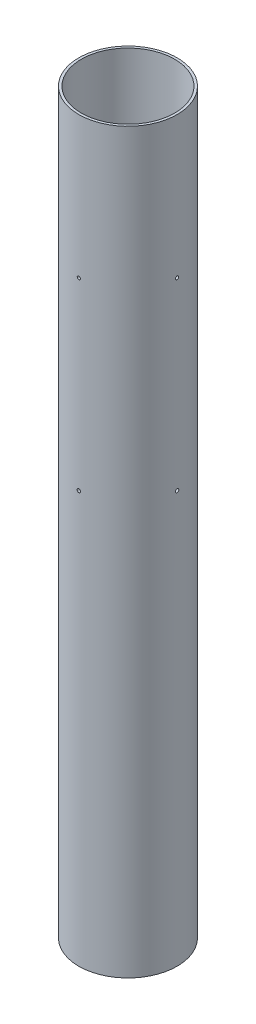
from build123d import *

# Parameters (mm, degrees)
SKETCH1_R                 = 50.8
SKETCH1_R_2               = 48.26
COUPLER_EXTRUSION_DEPTH   = 762
BULKHEAD_HOLE_REACH       = 772.42
SKETCH2_R                 = 1.6383
CIRPATTERN1_COUNT         = 4
LOWER_BULKHEAD_HOLE_REACH = 772.42
SKETCH3_R                 = 1.7526
CIRPATTERN2_COUNT         = 4


with BuildPart() as part:
    # Sketch1 → Coupler Extrusion (new body)
    with BuildSketch(Plane(origin=(0, 0, 0), x_dir=(1, 0, 0), z_dir=(0, 1, 0))):
        Circle(SKETCH1_R)
        Circle(SKETCH1_R_2, mode=Mode.SUBTRACT)
    extrude(amount=COUPLER_EXTRUSION_DEPTH)

    # Sketch2 → Bulkhead Hole (cut, up to next)
    with BuildSketch(Plane.XY.offset(50.8), mode=Mode.PRIVATE) as bulkhead_hole_sk1:
        with Locations((0, 615.95)):
            Circle(SKETCH2_R)
    bulkhead_hole_tool1 = extrude(bulkhead_hole_sk1.sketch, amount=-BULKHEAD_HOLE_REACH, mode=Mode.PRIVATE) & part.part
    bulkhead_hole = bulkhead_hole_tool1.solids().sort_by_distance((0, 615.95, 50.8))[0]
    add(bulkhead_hole, mode=Mode.SUBTRACT)

    # CirPattern1: Bulkhead Hole ×4 about axis
    cirpattern1_axis = Axis((0, 762, 0), (0, -1, 0))
    for i in range(1, CIRPATTERN1_COUNT):
        add(bulkhead_hole.rotate(cirpattern1_axis, i * 360 / CIRPATTERN1_COUNT), mode=Mode.SUBTRACT)

    # Sketch3 → Lower Bulkhead Hole (cut, up to next)
    with BuildSketch(Plane.XY.offset(50.8), mode=Mode.PRIVATE) as lower_bulkhead_hole_sk1:
        with Locations((0, 425.45)):
            Circle(SKETCH3_R)
    lower_bulkhead_hole_tool1 = extrude(lower_bulkhead_hole_sk1.sketch, amount=-LOWER_BULKHEAD_HOLE_REACH, mode=Mode.PRIVATE) & part.part
    lower_bulkhead_hole = lower_bulkhead_hole_tool1.solids().sort_by_distance((0, 425.45, 50.8))[0]
    add(lower_bulkhead_hole, mode=Mode.SUBTRACT)

    # CirPattern2: Lower Bulkhead Hole ×4 about axis
    cirpattern2_axis = Axis((0, 762, 0), (0, -1, 0))
    for i in range(1, CIRPATTERN2_COUNT):
        add(lower_bulkhead_hole.rotate(cirpattern2_axis, i * 360 / CIRPATTERN2_COUNT), mode=Mode.SUBTRACT)


solid = part.part
